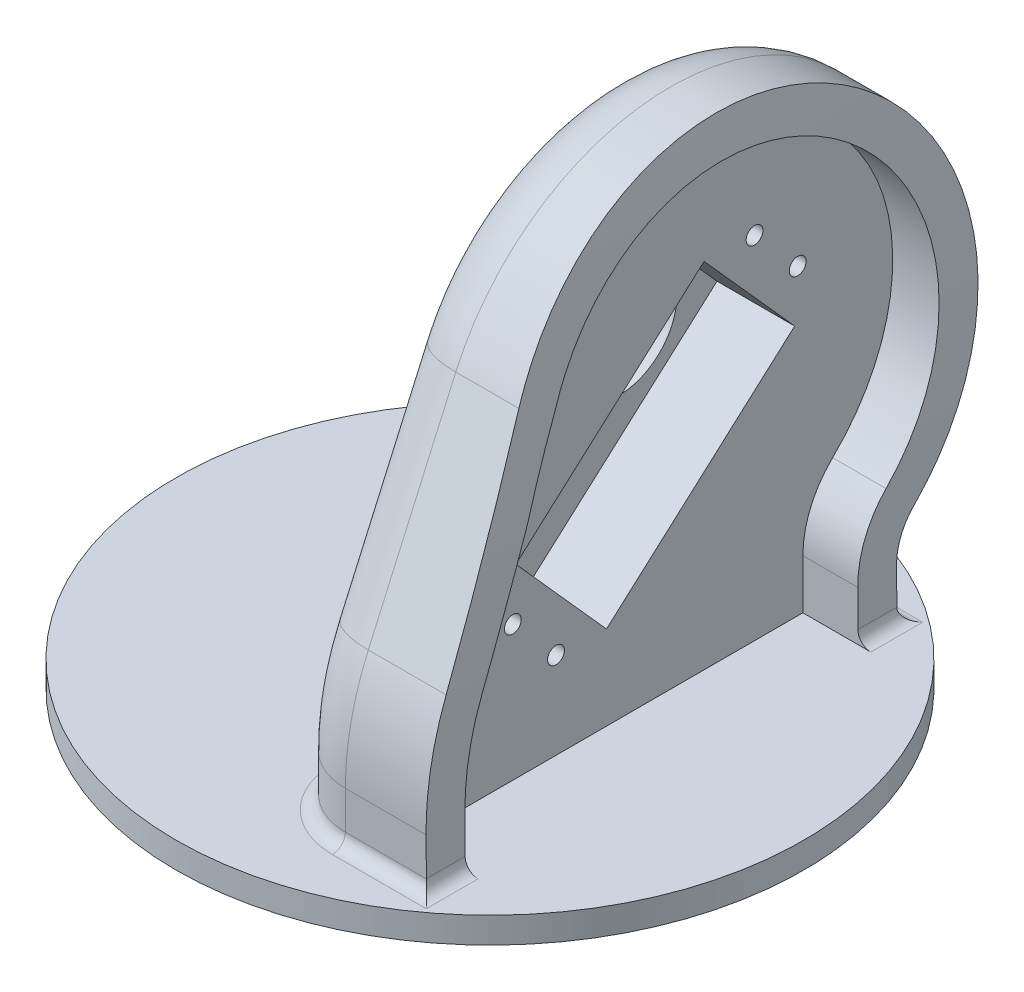
from build123d import *

# Parameters (mm, degrees)
SKETCH2_R                       = 48.5
SKETCH2_R_2                     = 1.5000000000000002
BOSS_EXTRUDE1_DEPTH             = 4
SKETCH3_R                       = 3.75
CUT_EXTRUDE1_DEPTH              = 1.5
BOSS_EXTRUDE3_START             = 4
SKETCH5_R                       = 9
BOSS_EXTRUDE3_DEPTH             = 14
CUT_EXTRUDE2_START              = 6
SKETCH9_R                       = 1.299999999999999
SKETCH9_R_2                     = 1.3000000000000043
SKETCH9_R_3                     = 1.2999999999999887
CUT_EXTRUDE2_DEPTH              = 96.33374378554642
BOSS_EXTRUDE6_DEPTH             = 9
BOSS_EXTRUDE6_DIRECTION_2_REACH = 113.079
CUT_EXTRUDE3_DEPTH              = 107.62868758356173
CUT_EXTRUDE3_DEPTH_BACK         = 107.62868758356173
FILLET2_R                       = 10
FILLET3_R                       = 2
FILLET4_R                       = 2


# Some blends are built 0.0001 mm under size
with BuildPart() as part:
    # Sketch2 → Boss-Extrude1 (new body)
    with BuildSketch(Plane(origin=(0, 0, 0), x_dir=(1, 0, 0), z_dir=(0, 1, 0))):
        with Locations(Location((0, 0, 0), (0, 0, 270))):
            Circle(SKETCH2_R)
        with Locations(Location((-2.66e-15, 7.249999999999999, 0), (0, 0, 270))):
            Circle(SKETCH2_R_2, mode=Mode.SUBTRACT)
        with Locations(Location((0, -7.249999999999999, 0), (0, 0, 270))):
            Circle(SKETCH2_R_2, mode=Mode.SUBTRACT)
    extrude(amount=BOSS_EXTRUDE1_DEPTH)

    # Sketch3 → Cut-Extrude1 (cut)
    with BuildSketch(Plane.XZ):
        with Locations(Location((0, 0, 0), (0, 0, 270))):
            Circle(SKETCH3_R)
    extrude(amount=-CUT_EXTRUDE1_DEPTH, mode=Mode.SUBTRACT)

    # Sketch5 → Boss-Extrude3 (add)
    with BuildSketch(Plane(origin=(0, 0, 0), x_dir=(0, 0, -1), z_dir=(1, 0, 0)).offset(BOSS_EXTRUDE3_START)):
        with BuildLine():
            Line((30.34, 4), (-30.34, 4))
            Line((-30.34, 4), (-30.34, 11.860000000000001))
            ThreePointArc((-30.34, 11.860000000000001), (-29.57328688616134, 19.16990813910404), (-27.306519613843914, 26.161644127699585))
            Line((-27.306519613843914, 26.161644127699585), (-13.792358873261465, 56.585344889913266))
            ThreePointArc((-13.792358873261465, 56.585344889913266), (31.303559206891457, 69.10551707656947), (34.93556554151654, 22.444986978202348))
            ThreePointArc((34.93556554151654, 22.444986978202348), (31.53662148462827, 17.510838233282712), (30.34, 11.64))
            Line((30.34, 11.64), (30.34, 4))
        make_face()
        with Locations((13.909999999999995, 44.28)):
            Circle(SKETCH5_R, mode=Mode.SUBTRACT)
    extrude(amount=BOSS_EXTRUDE3_DEPTH)

    # Sketch9 → Cut-Extrude2 (cut, through all)
    with BuildSketch(Plane(origin=(0, 0, 0), x_dir=(0, 0, -1), z_dir=(1, 0, 0)).offset(CUT_EXTRUDE2_START)):
        with Locations(Location((29.540705350702062, 50.78483624530012, 0), (0, 0, 180))):
            Circle(SKETCH9_R)
        with Locations(Location((22.87605932116741, 58.24020299020328, 0), (0, 0, 180))):
            Circle(SKETCH9_R)
        with Locations(Location((-7.795885678067851, 17.4081866892785, 0), (0, 0, 180))):
            Circle(SKETCH9_R_2)
        with Locations(Location((-14.460531707602502, 24.86355343418166, 0), (0, 0, 180))):
            Circle(SKETCH9_R_3)
        Polygon((0, 17), (29.075930305122334, 42.99211951518514), (15.080173643099549, 58.648389679481774), (-13.99575666202277, 32.65627016429665), align=None)
    extrude(amount=CUT_EXTRUDE2_DEPTH, mode=Mode.SUBTRACT)

    # Sketch11 → Boss-Extrude6 (add)
    with BuildSketch(Plane(origin=(18.000000000000004, 0, 0), x_dir=(0, 0, -1), z_dir=(1, 0, 0))):
        with BuildLine():
            ThreePointArc((39.09733932490991, 18.12299218692141), (34.7464182617029, 74.01944844856713), (-19.27572866273243, 59.02104925455133))
            Line((-19.27572866273244, 59.021049254551315), (-32.78988940331492, 28.59734849233759))
            ThreePointArc((-32.78988940331492, 28.59734849233759), (-35.44270843929697, 20.41485417471641), (-36.34, 11.860000000000007))
            Line((-36.34, 11.860000000000007), (-36.34, 4))
            Line((-36.34, 4), (-30.34, 4.000000000000001))
            Line((-30.34, 4), (-30.34, 11.860000000000001))
            ThreePointArc((-30.339999999999996, 11.860000000000003), (-29.573286886161334, 19.169908139104034), (-27.30651961384391, 26.161644127699585))
            Line((-27.30651961384391, 26.161644127699585), (-19.28989223747492, 44.20904471014288))
            ThreePointArc((-19.289892237474774, 44.20904471014282), (-16.709962361716535, 50.472191847815), (-13.792358873261435, 56.58534488991329))
            ThreePointArc((-13.79235887326144, 56.58534488991327), (31.303559206891478, 69.10551707656947), (34.935565541516546, 22.444986978202333))
            ThreePointArc((34.93556554151654, 22.444986978202337), (31.536621484628263, 17.510838233282712), (30.339999999999996, 11.64))
            Line((30.34, 11.64), (30.34, 4))
            Line((30.34, 4), (36.34, 4))
            Line((36.34, 4), (36.34, 11.64))
            ThreePointArc((36.34, 11.64), (37.05797289077695, 15.162502939969631), (39.09733932490992, 18.122992186921408))
        make_face()
    extrude(amount=BOSS_EXTRUDE6_DEPTH)

    # Boss-Extrude6 direction 2: up to this face of the body (flat: up to its plane)
    boss_extrude6_direction_2_end = Plane(part.part.faces().sort_by_distance((4, 35.761181815, -7.797700276))[0])
    # Sketch11 → Boss-Extrude6 direction 2 (add, up to the picked face)
    with BuildSketch(Plane(origin=(18.000000000000004, 0, 0), x_dir=(0, 0, -1), z_dir=(1, 0, 0)), mode=Mode.PRIVATE) as boss_extrude6_direction_2_sk1:
        with BuildLine():
            ThreePointArc((39.09733932490991, 18.12299218692141), (34.7464182617029, 74.01944844856713), (-19.27572866273243, 59.02104925455133))
            Line((-19.27572866273244, 59.021049254551315), (-32.78988940331492, 28.59734849233759))
            ThreePointArc((-32.78988940331492, 28.59734849233759), (-35.44270843929697, 20.41485417471641), (-36.34, 11.860000000000007))
            Line((-36.34, 11.860000000000007), (-36.34, 4))
            Line((-36.34, 4), (-30.34, 4.000000000000001))
            Line((-30.34, 4), (-30.34, 11.860000000000001))
            ThreePointArc((-30.339999999999996, 11.860000000000003), (-29.573286886161334, 19.169908139104034), (-27.30651961384391, 26.161644127699585))
            Line((-27.30651961384391, 26.161644127699585), (-19.28989223747492, 44.20904471014288))
            ThreePointArc((-19.289892237474774, 44.20904471014282), (-16.709962361716535, 50.472191847815), (-13.792358873261435, 56.58534488991329))
            ThreePointArc((-13.79235887326144, 56.58534488991327), (31.303559206891478, 69.10551707656947), (34.935565541516546, 22.444986978202333))
            ThreePointArc((34.93556554151654, 22.444986978202337), (31.536621484628263, 17.510838233282712), (30.339999999999996, 11.64))
            Line((30.34, 11.64), (30.34, 4))
            Line((30.34, 4), (36.34, 4))
            Line((36.34, 4), (36.34, 11.64))
            ThreePointArc((36.34, 11.64), (37.05797289077695, 15.162502939969631), (39.09733932490992, 18.122992186921408))
        make_face()
    boss_extrude6_direction_2_tool1 = split(extrude(boss_extrude6_direction_2_sk1.sketch, amount=-BOSS_EXTRUDE6_DIRECTION_2_REACH, mode=Mode.PRIVATE), bisect_by=boss_extrude6_direction_2_end, keep=Keep.BOTH, mode=Mode.PRIVATE)
    add(boss_extrude6_direction_2_tool1.solids().sort_by(Axis((18, 73.072836, -34.083191), (-1, 0, 0)))[0])

    # Sketch14 → Cut-Extrude3 (cut, two sides: drawn at the far end of the back side and taken through both)
    with BuildSketch(Plane.XY.offset(-CUT_EXTRUDE3_DEPTH_BACK)):
        with BuildLine():
            Line((27.00000000000001, 80.59240999991061), (21.00000000000001, 80.59240999991061))
            ThreePointArc((21.00000000000001, 80.59240999991061), (25.222549691509585, 42.401946852226466), (26.500000000000004, 4))
            Line((26.500000000000004, 4), (27.000000000000004, 4))
            Line((27.000000000000004, 4), (27.00000000000001, 80.59240999991061))
        make_face()
    extrude(amount=CUT_EXTRUDE3_DEPTH + CUT_EXTRUDE3_DEPTH_BACK, mode=Mode.SUBTRACT)

    # Fillet2
    # the kernel refuses this fillet: 10 mm, written as the material it takes off along each edge
    with BuildSketch(Plane(origin=(4, 11.860000000000007, 36.34), x_dir=(0, 0, -1), z_dir=(0, -1, 0))) as fillet2_piece_1:
        with BuildLine():
            CenterArc((FILLET2_R, FILLET2_R), FILLET2_R, 180, 90)
            Line((0, FILLET2_R), (0, 0))
            Line((0, 0), (FILLET2_R, 0))
        make_face()
    extrude(amount=7.8600000000000065, mode=Mode.SUBTRACT)
    with BuildSketch(Plane(origin=(4, 11.86, -4.889999999999912), x_dir=(0, 0.4059507274396709, 0.9138949649118339), z_dir=(0, 0.9138949649118339, -0.4059507274396709))) as fillet2_piece_2:
        with BuildLine():
            CenterArc((41.22999999999991 - FILLET2_R, FILLET2_R), FILLET2_R, 270, 89.99999999999999)
            Line((41.22999999999991, FILLET2_R), (41.22999999999991, 0))
            Line((41.22999999999991, 0), (41.22999999999991 - FILLET2_R, 0))
        make_face()
    revolve(axis=Axis((4, 11.86, -4.889999999999912), (1, 0, 0)), revolution_arc=23.950718342801608, mode=Mode.SUBTRACT)
    with BuildSketch(Plane(origin=(4, 59.02104925455132, 19.275728662732437), x_dir=(0, -0.4059507274396704, -0.9138949649118341), z_dir=(0, -0.9138949649118341, 0.40595072743967037))) as fillet2_piece_3:
        with BuildLine():
            CenterArc((FILLET2_R, FILLET2_R), FILLET2_R, 180, 90)
            Line((-3.25e-15, FILLET2_R), (0, 0))
            Line((0, 0), (FILLET2_R, 0))
        make_face()
    extrude(amount=33.29015032394755, mode=Mode.SUBTRACT)
    with BuildSketch(Plane(origin=(4, 44.28, -13.909999999999988), x_dir=(0, -0.7203324652134898, -0.6936289638988963), z_dir=(0, -0.6936289638988963, 0.7203324652134898))) as fillet2_piece_4:
        with BuildLine():
            CenterArc((36.312409999910614 - FILLET2_R, FILLET2_R), FILLET2_R, 270, 89.99999999999999)
            Line((36.312409999910614, FILLET2_R), (36.312409999910614, 0))
            Line((36.312409999910614, 0), (36.312409999910614 - FILLET2_R, 0))
        make_face()
    revolve(axis=Axis((4, 44.28, -13.909999999999988), (1, 0, 0)), revolution_arc=202.13121786262028, mode=Mode.SUBTRACT)
    with BuildSketch(Plane(origin=(4, 4, -36.34), x_dir=(0, 0, 1), z_dir=(0, 1, 0))) as fillet2_piece_5:
        with BuildLine():
            CenterArc((FILLET2_R, FILLET2_R), FILLET2_R, 180, 90)
            Line((0, FILLET2_R), (0, 0))
            Line((0, 0), (FILLET2_R, 0))
        make_face()
    extrude(amount=7.640000000000001, mode=Mode.SUBTRACT)
    with BuildSketch(Plane(origin=(4, 11.640000000000043, -45.33999999999995), x_dir=(0, 0.7203324652134898, 0.6936289638988964), z_dir=(0, 0.6936289638988964, -0.7203324652134898))) as fillet2_piece_6:
        with BuildLine():
            CenterArc((8.999999999999945 + FILLET2_R, FILLET2_R), FILLET2_R, 180, 90)
            Line((8.999999999999941, FILLET2_R), (8.999999999999945, 0))
            Line((8.999999999999945, 0), (8.999999999999945 + FILLET2_R, 0))
        make_face()
    revolve(axis=Axis((4, 11.640000000000043, -45.33999999999995), (1, 0, 0)), revolution_arc=46.08193620542221, mode=Mode.SUBTRACT)

    # Fillet3
    fillet3_edges = [part.edges().sort_by_distance(p)[0] for p in [
        (20.250000000000014, 4, -36.34),
        (4, 4, 0),
        (20.250000000000014, 4, 36.34),
        (6.928932188134525, 4, -33.41106781186548),
        (6.928932188134525, 3.999999999999999, 33.41106781186548),
    ]]
    fillet(fillet3_edges, radius=FILLET3_R)

    # Fillet4
    fillet4_edges = [part.edges().sort_by_distance(p)[0] for p in [
        (26.500000000000032, 4.000000000000001, -34.34),
        (26.500000000000036, 4.000000000000001, 34.34),
    ]]
    fillet(fillet4_edges, radius=FILLET4_R - 0.0001)  # a hair under: the kernel refuses the full size


solid = part.part
